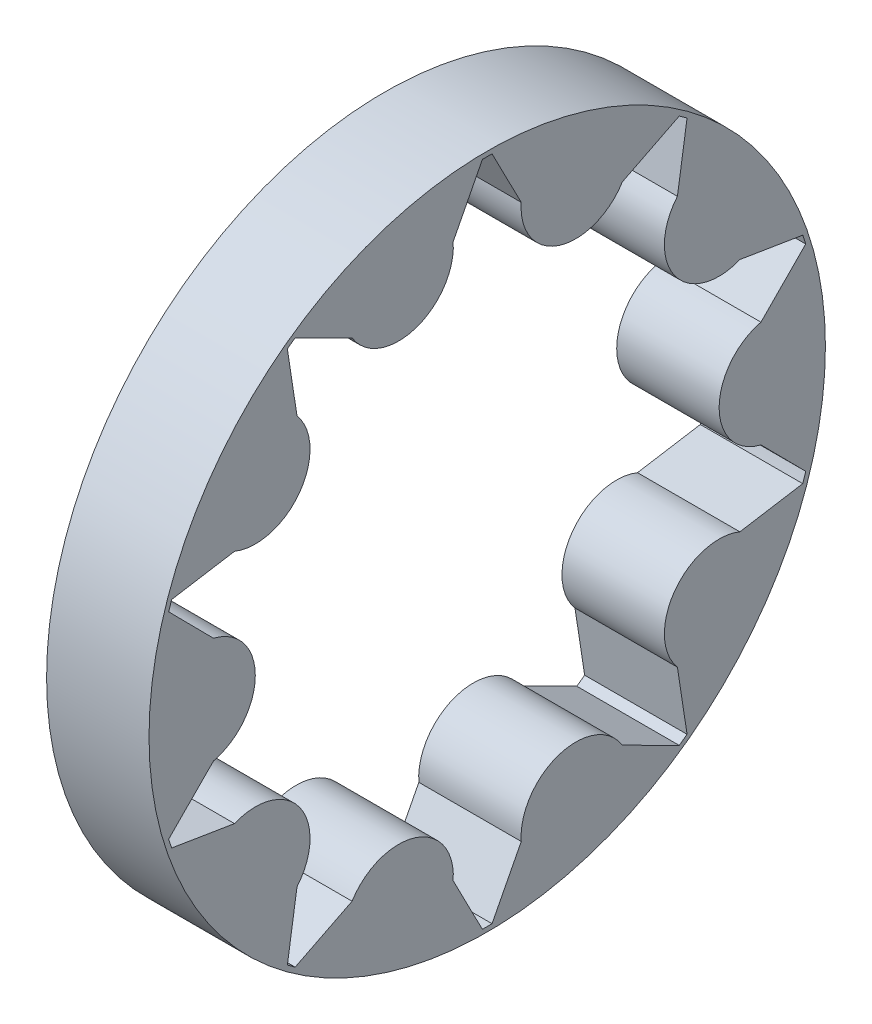
from build123d import *

# Parameters (mm, degrees)
BOSS_EXTRUDE1_DEPTH = 5.3
CIRPATTERN2_COUNT   = 10


with BuildPart() as part:
    # Sketch1 → Boss-Extrude1 (new body)
    with BuildSketch(Plane(origin=(0, 0, 0), x_dir=(0, 0, -1), z_dir=(1, 0, 0))):
        with BuildLine():
            Line((0, 17.5), (0, 17.25))
            ThreePointArc((0, 17.25), (0.125, 17.249547096), (0.249993436, 17.248188406))
            Line((0.249993436, 17.248188406), (1.761374949, 14.320141621))
            ThreePointArc((1.761374949, 14.320141621), (3.708203932, 11.412678196), (6.992185789, 12.620548152))
            Line((6.992185789, 12.620548152), (9.935981835, 14.101019997))
            ThreePointArc((9.935981835, 14.101019997), (10.037902267, 14.028649902), (10.139295602, 13.955543153))
            Line((10.139295602, 13.955543153), (10.286241915, 14.157797402))
            ThreePointArc((10.286241915, 14.157797402), (5.407797402, 16.643489035), (0, 17.5))
        make_face()
    boss_extrude1 = extrude(amount=BOSS_EXTRUDE1_DEPTH)

    # CirPattern2: Boss-Extrude1 ×10 about axis
    cirpattern2_axis = Axis((5.3, 0, 0), (-1, 0, 0))
    for i in range(1, CIRPATTERN2_COUNT):
        add(boss_extrude1.rotate(cirpattern2_axis, i * 360 / CIRPATTERN2_COUNT))


solid = part.part
